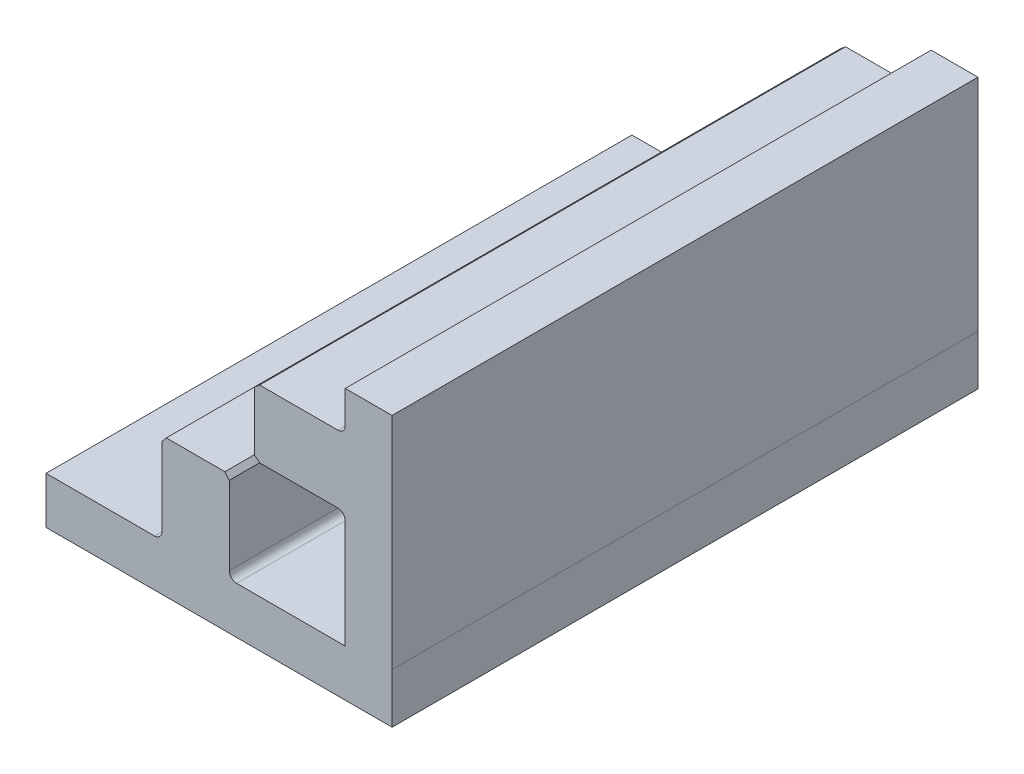
from build123d import *

# Parameters (mm, degrees)
BOSS_EXTRUDE1_DEPTH = 50.8
CUT_EXTRUDE1_REACH  = 61.846
CUT_EXTRUDE2_REACH  = 61.846


with BuildPart() as part:
    # Sketch1 → Boss-Extrude1 (new body)
    with BuildSketch(Plane(origin=(0, 0, -3683), x_dir=(-1, 0, 0), z_dir=(0, 0, -1))):
        with BuildLine():
            Line((7.945265893, 3.588862728), (-1.198734107, 3.588862728))
            ThreePointArc((-1.198734107, 3.588862728), (-1.647746913, 3.774849922), (-1.833734107, 4.223862728))
            Line((-1.833734107, 4.223862728), (-1.833734107, 5.747862728))
            ThreePointArc((-1.833734107, 5.747862728), (-1.647746913, 6.196875535), (-1.198734107, 6.382862728))
            Line((-1.198734107, 6.382862728), (1.621629442, 6.382862728))
            Line((1.621629442, 6.382862728), (1.621629442, 6.890862686))
            Line((1.621629442, 6.890862686), (-2.214734107, 11.462862728))
            Line((-2.214734107, 11.462862728), (-7.294734107, 11.462862728))
            Line((-7.294734107, 11.462862728), (-11.131097656, 6.890862686))
            Line((-11.131097656, 6.890862686), (-11.131097656, 6.382862728))
            Line((-11.131097656, 6.382862728), (-8.310734107, 6.382862728))
            ThreePointArc((-8.310734107, 6.382862728), (-7.861721301, 6.196875535), (-7.675734107, 5.747862728))
            Line((-7.675734107, 5.747862728), (-7.675734107, 4.223862728))
            ThreePointArc((-7.675734107, 4.223862728), (-7.861721301, 3.774849922), (-8.310734107, 3.588862728))
            Line((-8.310734107, 3.588862728), (-17.454734107, 3.588862728))
            Line((-17.454734107, 3.588862728), (-17.727921752, 3.588862728))
            Line((-17.727921752, 3.588862728), (-17.727921752, 3.858842754))
            Line((-17.727921752, 3.858842754), (-17.728361466, 13.002372481))
            ThreePointArc((-17.728361466, 13.002372481), (-17.542256287, 13.451715967), (-17.092921752, 13.637842754))
            Line((-17.092921752, 13.637842754), (-15.568921752, 13.637842754))
            ThreePointArc((-15.568921752, 13.637842754), (-15.119908946, 13.45185556), (-14.933921752, 13.002842754))
            Line((-14.933921752, 13.002842754), (-14.933921752, 10.182479205))
            Line((-14.933921752, 10.182479205), (-14.425921794, 10.182479205))
            Line((-14.425921794, 10.182479205), (-9.853921752, 14.018842754))
            Line((-9.853921752, 14.018842754), (-9.853921752, 19.098842754))
            Line((-9.853921752, 19.098842754), (-14.425921794, 22.935206303))
            Line((-14.425921794, 22.935206303), (-14.933921752, 22.935206303))
            Line((-14.933921752, 22.935206303), (-14.933921752, 20.114842754))
            ThreePointArc((-14.933921752, 20.114842754), (-15.119908946, 19.665829948), (-15.568921752, 19.479842754))
            Line((-15.568921752, 19.479842754), (-17.092921752, 19.479842754))
            ThreePointArc((-17.092921752, 19.479842754), (-17.542476558, 19.66604812), (-17.728703542, 20.11559397))
            Line((-17.728703542, 20.11559397), (-17.728839138, 22.935206303))
            Line((-17.728839138, 22.935206303), (-21.787214199, 22.935206303))
            Line((-21.787214199, 22.935206303), (-21.791921752, 3.859128788))
            Line((-21.791921752, 3.859128788), (-21.791921752, 3.588862728))
            Line((-21.791921752, 3.588862728), (-21.791921752, -0.475137272))
            Line((-21.791921752, -0.475137272), (-17.727921752, -0.475137272))
            Line((-17.727921752, -0.475137272), (-17.454774021, -0.475137272))
            Line((-17.454774021, -0.475137272), (7.945225979, -0.475137272))
            Line((7.945225979, -0.475137272), (8.215492039, -0.475137272))
            Line((8.215492039, -0.475137272), (8.215492039, 3.588862728))
            Line((8.215492039, 3.588862728), (7.945265893, 3.588862728))
        make_face()
    extrude(amount=BOSS_EXTRUDE1_DEPTH)

    # Sketch2 → Cut-Extrude1 (cut, up to next)
    with BuildSketch(Plane.XY.offset(-3683), mode=Mode.PRIVATE) as cut_extrude1_sk1:
        with BuildLine():
            Line((11.131097656, 6.890862686), (11.131097656, 6.382862728))
            Line((11.131097656, 6.382862728), (8.310734107, 6.382862728))
            ThreePointArc((8.310734107, 6.382862728), (7.861721301, 6.196875535), (7.675734107, 5.747862728))
            Line((7.675734107, 5.747862728), (7.675734107, 11.00880461))
            Line((7.675734107, 11.00880461), (11.131097656, 6.890862686))
        make_face()
    cut_extrude1_tool1 = extrude(cut_extrude1_sk1.sketch, amount=-CUT_EXTRUDE1_REACH, mode=Mode.PRIVATE) & part.part
    # Sketch2 → Cut-Extrude1 (cut, up to next)
    with BuildSketch(Plane.XY.offset(-3683), mode=Mode.PRIVATE) as cut_extrude1_sk2:
        with BuildLine():
            Line((1.833734107, 5.747862728), (1.833734107, 11.00880461))
            Line((1.833734107, 11.00880461), (-1.621629442, 6.890862686))
            Line((-1.621629442, 6.890862686), (-1.621629442, 6.382862728))
            Line((-1.621629442, 6.382862728), (1.198734107, 6.382862728))
            ThreePointArc((1.198734107, 6.382862728), (1.647746913, 6.196875535), (1.833734107, 5.747862728))
        make_face()
    cut_extrude1_tool2 = extrude(cut_extrude1_sk2.sketch, amount=-CUT_EXTRUDE1_REACH, mode=Mode.PRIVATE) & part.part
    add(cut_extrude1_tool1.solids().sort_by_distance((8.930632, 7.925168, -3683))[0], mode=Mode.SUBTRACT)
    add(cut_extrude1_tool2.solids().sort_by_distance((0.578837, 7.925168, -3683))[0], mode=Mode.SUBTRACT)

    # Sketch3 → Cut-Extrude2 (cut, up to next)
    with BuildSketch(Plane.XY.offset(-3683), mode=Mode.PRIVATE) as cut_extrude2_sk1:
        with BuildLine():
            Line((15.568921752, 19.479842754), (10.307979871, 19.479842754))
            Line((10.307979871, 19.479842754), (14.425921794, 22.935206303))
            Line((14.425921794, 22.935206303), (14.933921752, 22.935206303))
            Line((14.933921752, 22.935206303), (14.933921752, 20.114842754))
            ThreePointArc((14.933921752, 20.114842754), (15.119908946, 19.665829948), (15.568921752, 19.479842754))
        make_face()
    cut_extrude2_tool1 = extrude(cut_extrude2_sk1.sketch, amount=-CUT_EXTRUDE2_REACH, mode=Mode.PRIVATE) & part.part
    # Sketch3 → Cut-Extrude2 (cut, up to next)
    with BuildSketch(Plane.XY.offset(-3683), mode=Mode.PRIVATE) as cut_extrude2_sk2:
        with BuildLine():
            Line((10.307979871, 13.637842754), (14.425921794, 10.182479205))
            Line((14.425921794, 10.182479205), (14.933921752, 10.182479205))
            Line((14.933921752, 10.182479205), (14.933921752, 13.002842754))
            ThreePointArc((14.933921752, 13.002842754), (15.119908946, 13.45185556), (15.568921752, 13.637842754))
            Line((15.568921752, 13.637842754), (10.307979871, 13.637842754))
        make_face()
    cut_extrude2_tool2 = extrude(cut_extrude2_sk2.sketch, amount=-CUT_EXTRUDE2_REACH, mode=Mode.PRIVATE) & part.part
    add(cut_extrude2_tool1.solids().sort_by_distance((13.391616, 20.73474, -3683))[0], mode=Mode.SUBTRACT)
    add(cut_extrude2_tool2.solids().sort_by_distance((13.391616, 12.382945, -3683))[0], mode=Mode.SUBTRACT)


solid = part.part
